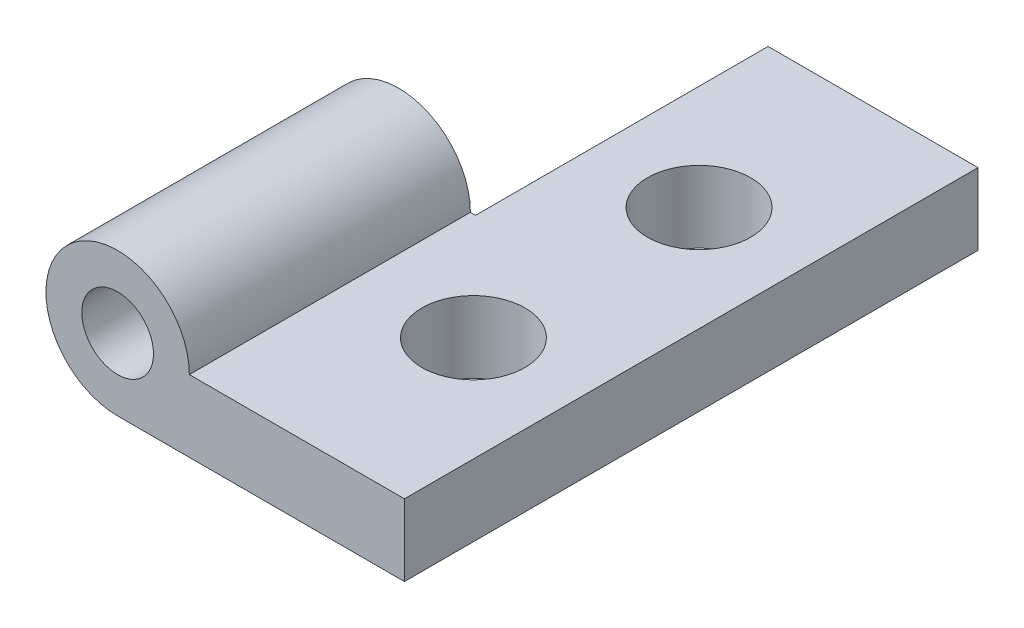
from build123d import *

# Parameters (mm, degrees)
BOSS_EXTRUDE1_DEPTH = 25.4
SKETCH3_R           = 3.409250276
CUT_EXTRUDE1_DEPTH  = 12.954
SKETCH4_R           = 0.009016574
SKETCH4_R_2         = 1.5875
CUT_EXTRUDE2_DEPTH  = 12.954
SKETCH5_R           = 2.286
CUT_EXTRUDE3_DEPTH  = 12.954


with BuildPart() as part:
    # Sketch2 → Boss-Extrude1 (new body)
    with BuildSketch(Plane.XY):
        with BuildLine():
            Line((0, 0), (-12.7, 0))
            ThreePointArc((-12.7, 0), (-14.94506403, 5.42006403), (-9.525, 3.175))
            Line((-9.525, 3.175), (0, 3.175))
            Line((0, 3.175), (0, 0))
        make_face()
    extrude(amount=BOSS_EXTRUDE1_DEPTH)

    # Sketch3 → Cut-Extrude1 (cut)
    with BuildSketch(Plane(origin=(0, 0, 0), x_dir=(-1, 0, 0), z_dir=(0, 0, -1))):
        with Locations((12.704799554, 3.194157658)):
            Circle(SKETCH3_R)
    extrude(amount=-CUT_EXTRUDE1_DEPTH, mode=Mode.SUBTRACT)

    # Sketch4 → Cut-Extrude2 (cut)
    with BuildSketch(Plane(origin=(0, 0, 12.954), x_dir=(-1, 0, 0), z_dir=(0, 0, -1))):
        with Locations((13.078560125, 6.336432235)):
            Circle(SKETCH4_R)
        with Locations((12.7, 3.175)):
            Circle(SKETCH4_R_2)
    extrude(amount=-CUT_EXTRUDE2_DEPTH, mode=Mode.SUBTRACT)

    # Sketch5 → Cut-Extrude3 (cut)
    with BuildSketch(Plane(origin=(0, 3.175, 0), x_dir=(1, 0, 0), z_dir=(0, 1, 0))):
        with Locations((-4.647801552, -17.695333333)):
            Circle(SKETCH5_R)
        with Locations((-4.647801552, -7.704666667)):
            Circle(SKETCH5_R)
    extrude(amount=-CUT_EXTRUDE3_DEPTH, mode=Mode.SUBTRACT)


solid = part.part
